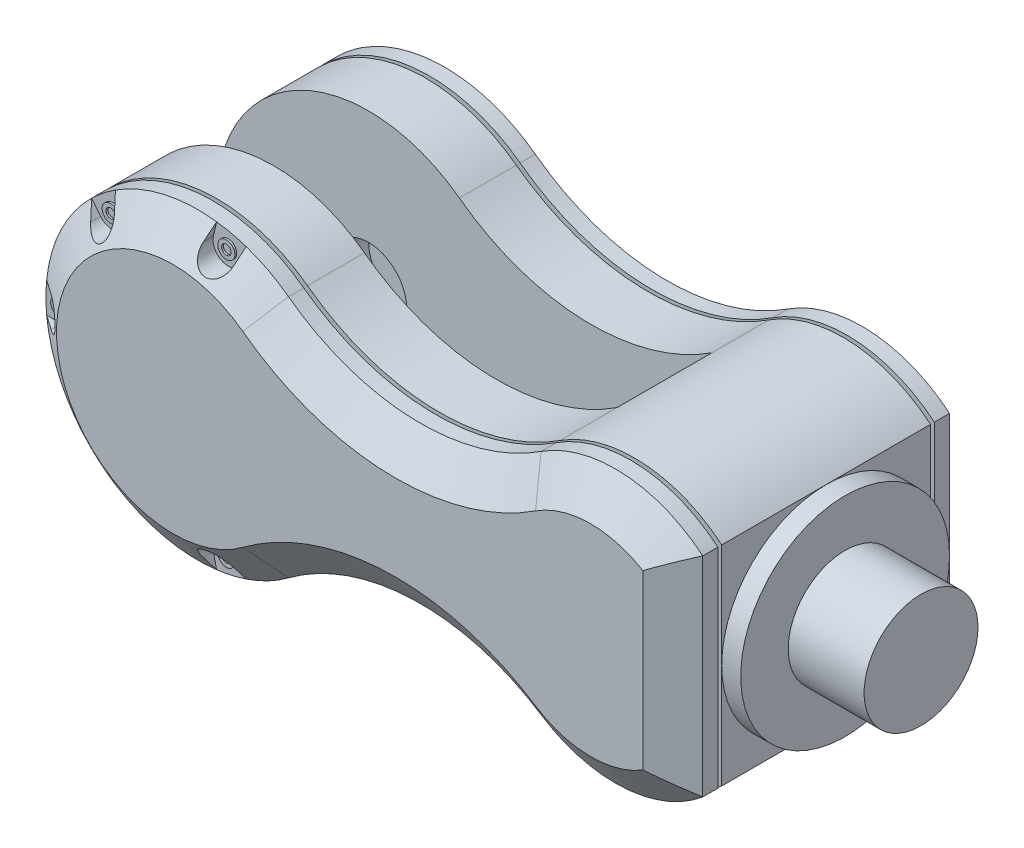
from build123d import *

# Parameters (mm, degrees)
SKETCH1_R            = 27.5
BOSS_EXTRUDE1_DEPTH  = 5
BOSS_EXTRUDE2_DEPTH  = 15
BOSS_EXTRUDE3_DEPTH  = 1
BOSS_EXTRUDE6_DEPTH  = 4
BOSS_EXTRUDE7_DEPTH  = 6.5
BOSS_EXTRUDE7_DRAFT  = 55
CUT_EXTRUDE1_DEPTH   = 6.5
SKETCH8_R            = 2.25
SKETCH8_R_2          = 1.25
BOSS_EXTRUDE8_DEPTH  = 0.5
CIRPATTERN1_COUNT    = 7
BOSS_EXTRUDE9_DEPTH  = 40
SKETCH10_R           = 15
BOSS_EXTRUDE10_DEPTH = 20
SKETCH11_R           = 10
CUT_EXTRUDE2_DEPTH   = 10


# Read off the part's stored shape, not the designer's step: Mirror1
with BuildPart() as part:
    # Sketch1 → Boss-Extrude1 (new body)
    with BuildSketch(Plane(origin=(0, 0, 0), x_dir=(0, 0, -1), z_dir=(1, 0, 0))):
        Circle(SKETCH1_R)
    extrude(amount=BOSS_EXTRUDE1_DEPTH)

    # Sketch2 → Boss-Extrude2 (add)
    with BuildSketch(Plane.XY.offset(-27.5)):
        with BuildLine():
            Line((0, -27.5), (0, 27.5))
            ThreePointArc((0, 27.5), (-20.888803988, 35.78816636), (-42.607197268, 30.013460569))
            ThreePointArc((-42.607197268, 30.013460569), (-76.174583663, 20.58333257), (-109.094707542, 32.070812158))
            ThreePointArc((-109.094707542, 32.070812158), (-173, 0), (-109.094707542, -32.070812158))
            ThreePointArc((-109.094707542, -32.070812158), (-76.174583663, -20.58333257), (-42.607197268, -30.013460569))
            ThreePointArc((-42.607197268, -30.013460569), (-20.888803988, -35.78816636), (0, -27.5))
        make_face()
    extrude(amount=BOSS_EXTRUDE2_DEPTH)

    # Sketch3 → Boss-Extrude3 (add)
    with BuildSketch(Plane(origin=(0, 0, -27.5), x_dir=(-1, 0, 0), z_dir=(0, 0, -1))):
        with BuildLine():
            Line((2.5, 26.305856426), (2.5, 0))
            Line((2.5, 0), (2.5, -26.305856426))
            ThreePointArc((2.5, -26.305856426), (21.611197519, -33.321454199), (41.239903858, -27.920494078))
            ThreePointArc((41.239903858, -27.920494078), (76.251905228, -18.084528581), (110.58878832, -30.066386398))
            ThreePointArc((110.58878832, -30.066386398), (170.5, 0), (110.58878832, 30.066386398))
            ThreePointArc((110.58878832, 30.066386398), (76.251905228, 18.084528581), (41.239903858, 27.920494078))
            ThreePointArc((41.239903858, 27.920494078), (21.611197519, 33.321454199), (2.5, 26.305856426))
        make_face()
    extrude(amount=BOSS_EXTRUDE3_DEPTH)

    # Sketch5 → Boss-Extrude6 (add)
    # profile 1 of 2: a face of its own
    with BuildSketch(Plane(origin=(0, 0, -28.5), x_dir=(-1, 0, 0), z_dir=(0, 0, -1))):
        with BuildLine():
            ThreePointArc((42.607197268, 30.013460569), (76.174583663, 20.58333257), (109.094707542, 32.070812158))
            ThreePointArc((109.094707542, 32.070812158), (173, 0), (109.094707542, -32.070812158))
            ThreePointArc((109.094707542, -32.070812158), (76.174583663, -20.58333257), (42.607197268, -30.013460569))
            ThreePointArc((42.607197268, -30.013460569), (20.888803988, -35.78816636), (0, -27.5))
            Line((0, -27.5), (0, 0))
            Line((0, 0), (0, 27.5))
            ThreePointArc((0, 27.5), (20.888803988, 35.78816636), (42.607197268, 30.013460569))
        make_face()
        with BuildLine():
            ThreePointArc((2.5, -26.305856426), (21.611197519, -33.321454199), (41.239903858, -27.920494078))
            ThreePointArc((41.239903858, -27.920494078), (76.251905228, -18.084528581), (110.58878832, -30.066386398))
            ThreePointArc((110.58878832, -30.066386398), (170.5, 0), (110.58878832, 30.066386398))
            ThreePointArc((110.58878832, 30.066386398), (76.251905228, 18.084528581), (41.239903858, 27.920494078))
            ThreePointArc((41.239903858, 27.920494078), (21.611197519, 33.321454199), (2.5, 26.305856426))
            Line((2.5, 26.305856426), (2.5, -26.305856426))
        make_face(mode=Mode.SUBTRACT)
    # profile 2 of 2: a face of its own
    with BuildSketch(Plane(origin=(0, 0, -28.5), x_dir=(-1, 0, 0), z_dir=(0, 0, -1))):
        with BuildLine():
            Line((2.5, 26.305856426), (2.5, -26.305856426))
            ThreePointArc((2.5, -26.305856426), (21.611197519, -33.321454199), (41.239903858, -27.920494078))
            ThreePointArc((41.239903858, -27.920494078), (76.251905228, -18.084528581), (110.58878832, -30.066386398))
            ThreePointArc((110.58878832, -30.066386398), (170.5, 0), (110.58878832, 30.066386398))
            ThreePointArc((110.58878832, 30.066386398), (76.251905228, 18.084528581), (41.239903858, 27.920494078))
            ThreePointArc((41.239903858, 27.920494078), (21.611197519, 33.321454199), (2.5, 26.305856426))
        make_face()
    extrude(amount=BOSS_EXTRUDE6_DEPTH)


with BuildPart() as boss_extrude7_tool:
    # Sketch6 → Boss-Extrude7 (with draft: the straight prism first)
    with BuildSketch(Plane(origin=(0, 0, -32.5), x_dir=(-1, 0, 0), z_dir=(0, 0, -1))):
        with BuildLine():
            Line((0, 27.5), (0, -27.5))
            ThreePointArc((0, -27.5), (20.888803988, -35.78816636), (42.607197268, -30.013460569))
            ThreePointArc((42.607197268, -30.013460569), (76.174583663, -20.58333257), (109.094707542, -32.070812158))
            ThreePointArc((109.094707542, -32.070812158), (173, 0), (109.094707542, 32.070812158))
            ThreePointArc((109.094707542, 32.070812158), (76.174583663, 20.58333257), (42.607197268, 30.013460569))
            ThreePointArc((42.607197268, 30.013460569), (20.888803988, 35.78816636), (0, 27.5))
        make_face()
    extrude(amount=BOSS_EXTRUDE7_DEPTH)
    # Boss-Extrude7: the draft: its side faces are tilted about the plane it starts from
    boss_extrude7_sides = [boss_extrude7_tool.faces().sort_by_distance(p)[0] for p in [
        (-20.888803988, 35.78816636, -35.75),
        (0, 0, -35.75),
        (-20.888803988, -35.78816636, -35.75),
        (-76.174583663, -20.58333257, -35.75),
        (-173, 0, -35.75),
        (-76.174583663, 20.58333257, -35.75),
    ]]
    draft(boss_extrude7_sides, Plane(origin=(0, 0, -32.5), x_dir=(-1, 0, 0), z_dir=(0, 0, -1)), BOSS_EXTRUDE7_DRAFT)


with BuildPart() as part_1:
    add(part.part)

    # Boss-Extrude7: add boss_extrude7_tool
    add(boss_extrude7_tool.part)

    # Sketch7 → Cut-Extrude1 (cut)
    with BuildSketch(Plane(origin=(0, 0, -39), x_dir=(-1, 0, 0), z_dir=(0, 0, -1))):
        with BuildLine():
            Line((169, 4), (174.666272359, 4))
            Line((174.666272359, 4), (174.666272359, -4))
            Line((174.666272359, -4), (169, -4))
            ThreePointArc((169, -4), (165, 0), (169, 4))
        make_face()
    cut_extrude1 = extrude(amount=-CUT_EXTRUDE1_DEPTH, mode=Mode.SUBTRACT)

    # Sketch8 → Boss-Extrude8 (add)
    with BuildSketch(Plane(origin=(0, 0, -32.5), x_dir=(-1, 0, 0), z_dir=(0, 0, -1))):
        with Locations((169, 0)):
            Circle(SKETCH8_R)
        with Locations((169, 0)):
            Circle(SKETCH8_R_2, mode=Mode.SUBTRACT)
    boss_extrude8 = extrude(amount=BOSS_EXTRUDE8_DEPTH)

    # CirPattern1: Cut-Extrude1, Boss-Extrude8 ×7 about axis, 2 skipped
    cirpattern1_axis = Axis((-133, 0, 0), (0, 0, 1))
    add([cut_extrude1.rotate(cirpattern1_axis, i * 360 / CIRPATTERN1_COUNT) for i in range(1, CIRPATTERN1_COUNT) if i not in (3, 4)], mode=Mode.SUBTRACT)
    add([boss_extrude8.rotate(cirpattern1_axis, i * 360 / CIRPATTERN1_COUNT) for i in range(1, CIRPATTERN1_COUNT) if i not in (3, 4)])

    # Sketch9 → Boss-Extrude9 (add)
    with BuildSketch(Plane.XY.offset(-12.5)):
        with BuildLine():
            Line((-42.607197268, 30.013460569), (-42.607197268, -30.013460569))
            ThreePointArc((-42.607197268, -30.013460569), (-20.888803988, -35.78816636), (0, -27.5))
            Line((0, -27.5), (0, -24.494897428))
            Line((0, -24.494897428), (0, 24.494897428))
            Line((0, 24.494897428), (0, 27.5))
            ThreePointArc((0, 27.5), (-20.888803988, 35.78816636), (-42.607197268, 30.013460569))
        make_face()
    extrude(amount=BOSS_EXTRUDE9_DEPTH)

    # Mirror1: part across plane


with BuildPart() as part_2:
    add(part_1.part)
    add(part_1.part.mirror(Plane.XY))

    # Sketch10 → Boss-Extrude10 (add)
    with BuildSketch(Plane(origin=(5, 0, 0), x_dir=(0, 0, -1), z_dir=(1, 0, 0))):
        Circle(SKETCH10_R)
    extrude(amount=BOSS_EXTRUDE10_DEPTH)

    # Sketch11 → Cut-Extrude2 (cut)
    with BuildSketch(Plane(origin=(0, 0, 12.5), x_dir=(-1, 0, 0), z_dir=(0, 0, -1))):
        with Locations((133, 0)):
            Circle(SKETCH11_R)
    cut_extrude2 = extrude(amount=-CUT_EXTRUDE2_DEPTH, mode=Mode.SUBTRACT)

    # Mirror2: Cut-Extrude2 across plane
    add(cut_extrude2.mirror(Plane.XY), mode=Mode.SUBTRACT)


solid = part_2.part
